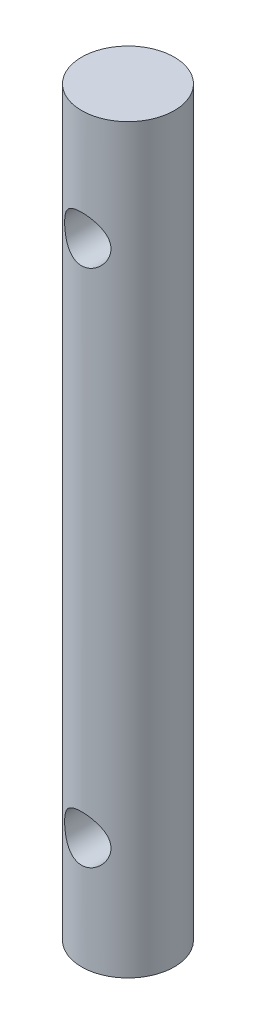
from build123d import *

# Parameters (mm, degrees)
SKETCH1_R               = 3.175
BOSS_EXTRUDE1_DEPTH     = 50.8
CUT_EXTRUDE1_DEPTH      = 12.192
CUT_EXTRUDE1_DEPTH_BACK = 11.176
SKETCH2_R               = 1.5875
CUT_EXTRUDE2_DEPTH      = 11.176
CUT_EXTRUDE2_DEPTH_BACK = 11.176
SKETCH3_R               = 1.5875


with BuildPart() as part:
    # Sketch1 → Boss-Extrude1 (new body)
    with BuildSketch(Plane(origin=(0, 0, 0), x_dir=(1, 0, 0), z_dir=(0, 1, 0))):
        Circle(SKETCH1_R)
    extrude(amount=BOSS_EXTRUDE1_DEPTH)

    # Sketch2 → Cut-Extrude1 (cut, two sides: drawn at the far end of the back side and taken through both)
    with BuildSketch(Plane.XY.offset(-CUT_EXTRUDE1_DEPTH_BACK)):
        with Locations((0, 43.18)):
            Circle(SKETCH2_R)
    extrude(amount=CUT_EXTRUDE1_DEPTH + CUT_EXTRUDE1_DEPTH_BACK, mode=Mode.SUBTRACT)

    # Sketch3 → Cut-Extrude2 (cut, two sides: drawn at the far end of the back side and taken through both)
    with BuildSketch(Plane.XY.offset(-CUT_EXTRUDE2_DEPTH_BACK)):
        with Locations((0, 7.62)):
            Circle(SKETCH3_R)
    extrude(amount=CUT_EXTRUDE2_DEPTH + CUT_EXTRUDE2_DEPTH_BACK, mode=Mode.SUBTRACT)


solid = part.part
